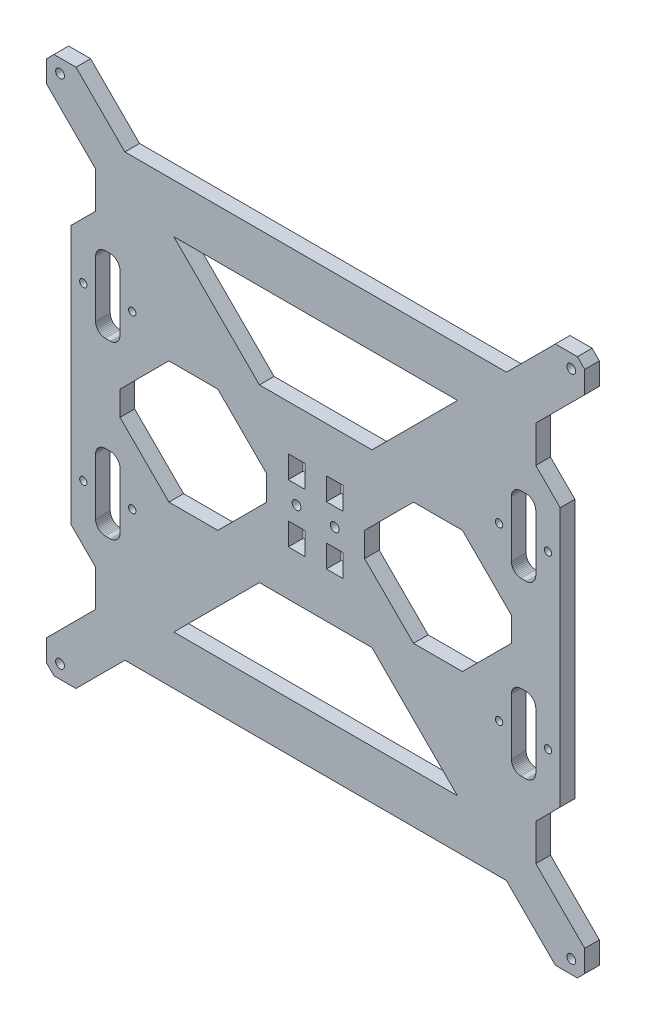
from build123d import *

# Parameters (mm, degrees)
MODEL_R                  = 1.8
MODEL_R_2                = 1.5
MODEL_W                  = 6.800001918
MODEL_H                  = 9.1999977
MODEL_W_2                = 6.800001917
MODEL_H_2                = 9.199995837
RESSALTO_EXTRUS_O1_DEPTH = 6


with BuildPart() as part:
    # Model → Ressalto-extrusão1 (new body)
    with BuildSketch(Plane.XY):
        Polygon((31.002090355, 14.825573059), (40.002088675, 14.825573059), (60.002081075, 34.825565459), (216.002031155, 34.825565459), (236.002023555, 14.825573059), (245.002021875, 14.825573059), (248.002020915, 17.825572099), (248.002020915, 26.825570419), (228.002027315, 46.825564019), (228.002027315, 61.825558019), (238.002024115, 71.825554819), (238.002024115, 177.825520899), (228.002027315, 187.825517699), (228.002027315, 202.825511699), (248.002020915, 222.825505299), (248.002020915, 231.825503619), (245.002021875, 234.825502659), (236.002023555, 234.825502659), (216.002031155, 214.825510259), (60.002081075, 214.825510259), (40.002088675, 234.825502659), (31.002090355, 234.825502659), (28.002091315, 231.825503619), (28.002091315, 222.825505299), (48.002084915, 202.825511699), (48.002084915, 187.825517699), (38.002088115, 177.825520899), (38.002088115, 71.825554819), (48.002084915, 61.825558019), (48.002084915, 46.825564019), (28.002091315, 26.825570419), (28.002091315, 17.825572099), align=None)
        with Locations((33.491707299, 20.335953555)):
            Circle(MODEL_R, mode=Mode.SUBTRACT)
        with Locations((43.002086515, 89.851104681)):
            Circle(MODEL_R_2, mode=Mode.SUBTRACT)
        Polygon((50.002084275, 105.289645726), (50.471350396, 105.521062167), (50.966807786, 105.689247288), (51.479979033, 105.791323396), (52.002083635, 105.825543939), (54.002082995, 105.825543939), (54.524187597, 105.791323396), (55.037358844, 105.689247288), (55.532816235, 105.521062167), (56.002082355, 105.289645726), (56.437127932, 104.998957565), (56.830509215, 104.653971439), (57.175495341, 104.260590156), (57.466183502, 103.825544579), (57.697599943, 103.356278459), (57.865785064, 102.860821068), (57.967861172, 102.347649821), (58.002081715, 101.825545219), (58.002081715, 78.825552579), (57.967861172, 78.303447977), (57.865785064, 77.79027673), (57.697599943, 77.294819339), (57.466183502, 76.825553219), (57.175495341, 76.390507642), (56.830509215, 75.997126359), (56.437127932, 75.652140233), (56.002082355, 75.361452072), (55.532816235, 75.130035632), (55.037358844, 74.96185051), (54.524187597, 74.859774403), (54.002082995, 74.825553859), (52.002083635, 74.825553859), (51.479979033, 74.859774403), (50.966807786, 74.96185051), (50.471350396, 75.130035632), (50.002084275, 75.361452072), (49.567038698, 75.652140233), (49.173657416, 75.997126359), (48.828671289, 76.390507642), (48.537983129, 76.825553219), (48.306566688, 77.294819339), (48.138381566, 77.79027673), (48.036305459, 78.303447977), (48.002084915, 78.825552579), (48.002084915, 101.825545219), (48.036305459, 102.347649821), (48.138381566, 102.860821068), (48.306566688, 103.356278459), (48.537983129, 103.825544579), (48.828671289, 104.260590156), (49.173657416, 104.653971439), (49.567038698, 104.998957565), align=None, mode=Mode.SUBTRACT)
        with Locations((63.002080115, 89.825549059)):
            Circle(MODEL_R_2, mode=Mode.SUBTRACT)
        Polygon((80.002077075, 54.825561459), (115.002064675, 89.825549059), (161.002047555, 89.825549059), (196.002035155, 54.825561459), align=None, mode=Mode.SUBTRACT)
        Polygon((98.002068915, 149.825529859), (118.002062515, 129.825536259), (118.002062515, 119.825539459), (98.002068915, 99.825545859), (78.002075315, 99.825545859), (58.002081715, 119.825539459), (58.002081715, 129.825536259), (78.002075315, 149.825529859), align=None, mode=Mode.SUBTRACT)
        with Locations((130.200200449, 112.959129261)):
            Rectangle(MODEL_W, MODEL_H, mode=Mode.SUBTRACT)
        with Locations((242.512404931, 20.335953555)):
            Circle(MODEL_R, mode=Mode.SUBTRACT)
        with Locations((145.803911782, 112.959129261)):
            Rectangle(MODEL_W_2, MODEL_H, mode=Mode.SUBTRACT)
        Polygon((158.002049715, 119.825539459), (158.002049715, 129.825536259), (178.002043315, 149.825529859), (198.002036915, 149.825529859), (218.002030515, 129.825536259), (218.002030515, 119.825539459), (198.002036915, 99.825545859), (178.002043315, 99.825545859), align=None, mode=Mode.SUBTRACT)
        with Locations((213.002032115, 89.825549059)):
            Circle(MODEL_R_2, mode=Mode.SUBTRACT)
        Polygon((225.037304444, 105.689247288), (225.532761835, 105.521062167), (226.002027955, 105.289645726), (226.437073532, 104.998957565), (226.830454815, 104.653971439), (227.175440941, 104.260590156), (227.466129102, 103.825544579), (227.697545543, 103.356278459), (227.865730664, 102.860821068), (227.967806772, 102.347649821), (228.002027315, 101.825545219), (228.002027315, 78.825552579), (227.967806772, 78.303447977), (227.865730664, 77.79027673), (227.697545543, 77.294819339), (227.466129102, 76.825553219), (227.175440941, 76.390507642), (226.830454815, 75.997126359), (226.437073532, 75.652140233), (226.002027955, 75.361452072), (225.532761835, 75.130035632), (225.037304444, 74.96185051), (224.524133197, 74.859774403), (224.002028595, 74.825553859), (222.002029235, 74.825553859), (221.479924633, 74.859774403), (220.966753386, 74.96185051), (220.471295996, 75.130035632), (220.002029875, 75.361452072), (219.566984298, 75.652140233), (219.173603016, 75.997126359), (218.82861689, 76.390507642), (218.537928729, 76.825553219), (218.306512288, 77.294819339), (218.138327166, 77.79027673), (218.036251059, 78.303447977), (218.002030515, 78.825552579), (218.002030515, 101.825545219), (218.036251059, 102.347649821), (218.138327166, 102.860821068), (218.306512288, 103.356278459), (218.537928729, 103.825544579), (218.82861689, 104.260590156), (219.173603016, 104.653971439), (219.566984298, 104.998957565), (220.002029875, 105.289645726), (220.471295996, 105.521062167), (220.966753386, 105.689247288), (221.479924633, 105.791323396), (222.002029235, 105.825543939), (224.002028595, 105.825543939), (224.524133197, 105.791323396), align=None, mode=Mode.SUBTRACT)
        with Locations((233.002025715, 89.851104681)):
            Circle(MODEL_R_2, mode=Mode.SUBTRACT)
        with Locations((43.002086515, 159.825526659)):
            Circle(MODEL_R_2, mode=Mode.SUBTRACT)
        Polygon((57.697599943, 173.363292953), (57.865785064, 172.867835562), (57.967861172, 172.354664315), (58.002081715, 171.832559713), (58.002081715, 148.832567073), (57.967861172, 148.310462471), (57.865785064, 147.797291224), (57.697599943, 147.301833833), (57.466183502, 146.832567713), (57.175495341, 146.397522136), (56.830509215, 146.004140853), (56.437127932, 145.659154727), (56.002082355, 145.368466566), (55.532816235, 145.137050125), (55.037358844, 144.968865004), (54.524187597, 144.866788896), (54.002082995, 144.832568353), (52.002083635, 144.832568353), (51.479979033, 144.866788896), (50.966807786, 144.968865004), (50.471350396, 145.137050125), (50.002084275, 145.368466566), (49.567038698, 145.659154727), (49.173657416, 146.004140853), (48.828671289, 146.397522136), (48.537983129, 146.832567713), (48.306566688, 147.301833833), (48.138381566, 147.797291224), (48.036305459, 148.310462471), (48.002084915, 148.832567073), (48.002084915, 171.832559713), (48.036305459, 172.354664315), (48.138381566, 172.867835562), (48.306566688, 173.363292953), (48.537983129, 173.832559073), (48.828671289, 174.26760465), (49.173657416, 174.660985933), (49.567038698, 175.005972059), (50.002084275, 175.29666022), (50.471350396, 175.52807666), (50.966807786, 175.696261782), (51.479979033, 175.798337889), (52.002083635, 175.832558433), (54.002082995, 175.832558433), (54.524187597, 175.798337889), (55.037358844, 175.696261782), (55.532816235, 175.52807666), (56.002082355, 175.29666022), (56.437127932, 175.005972059), (56.830509215, 174.660985933), (57.175495341, 174.26760465), (57.466183502, 173.832559073), align=None, mode=Mode.SUBTRACT)
        with Locations((63.002080115, 159.825526659)):
            Circle(MODEL_R_2, mode=Mode.SUBTRACT)
        with Locations((130.1984756, 124.859381659)):
            Circle(MODEL_R, mode=Mode.SUBTRACT)
        with Locations((130.200200449, 136.759120091)):
            Rectangle(MODEL_W, MODEL_H_2, mode=Mode.SUBTRACT)
        Polygon((115.002064675, 159.825526659), (80.002077075, 194.825514259), (196.002035155, 194.825514259), (161.002047555, 159.825526659), align=None, mode=Mode.SUBTRACT)
        with Locations((33.491707299, 229.335886675)):
            Circle(MODEL_R, mode=Mode.SUBTRACT)
        with Locations((145.805636631, 124.859381659)):
            Circle(MODEL_R, mode=Mode.SUBTRACT)
        with Locations((145.803911782, 136.759120091)):
            Rectangle(MODEL_W_2, MODEL_H_2, mode=Mode.SUBTRACT)
        with Locations((213.002032115, 159.825526659)):
            Circle(MODEL_R_2, mode=Mode.SUBTRACT)
        Polygon((218.036251059, 172.354664315), (218.138327166, 172.867835562), (218.306512288, 173.363292953), (218.537928729, 173.832559073), (218.82861689, 174.26760465), (219.173603016, 174.660985933), (219.566984298, 175.005972059), (220.002029875, 175.29666022), (220.471295996, 175.52807666), (220.966753386, 175.696261782), (221.479924633, 175.798337889), (222.002029235, 175.832558433), (224.002028595, 175.832558433), (224.524133197, 175.798337889), (225.037304444, 175.696261782), (225.532761835, 175.52807666), (226.002027955, 175.29666022), (226.437073532, 175.005972059), (226.830454815, 174.660985933), (227.175440941, 174.26760465), (227.466129102, 173.832559073), (227.697545543, 173.363292953), (227.865730664, 172.867835562), (227.967806772, 172.354664315), (228.002027315, 171.832559713), (228.002027315, 148.832567073), (227.967806772, 148.310462471), (227.865730664, 147.797291224), (227.697545543, 147.301833833), (227.466129102, 146.832567713), (227.175440941, 146.397522136), (226.830454815, 146.004140853), (226.437073532, 145.659154727), (226.002027955, 145.368466566), (225.532761835, 145.137050125), (225.037304444, 144.968865004), (224.524133197, 144.866788896), (224.002028595, 144.832568353), (222.002029235, 144.832568353), (221.479924633, 144.866788896), (220.966753386, 144.968865004), (220.471295996, 145.137050125), (220.002029875, 145.368466566), (219.566984298, 145.659154727), (219.173603016, 146.004140853), (218.82861689, 146.397522136), (218.537928729, 146.832567713), (218.306512288, 147.301833833), (218.138327166, 147.797291224), (218.036251059, 148.310462471), (218.002030515, 148.832567073), (218.002030515, 171.832559713), align=None, mode=Mode.SUBTRACT)
        with Locations((233.002025715, 159.825526659)):
            Circle(MODEL_R_2, mode=Mode.SUBTRACT)
        with Locations((242.512404931, 229.335886675)):
            Circle(MODEL_R, mode=Mode.SUBTRACT)
    extrude(amount=RESSALTO_EXTRUS_O1_DEPTH)


solid = part.part
